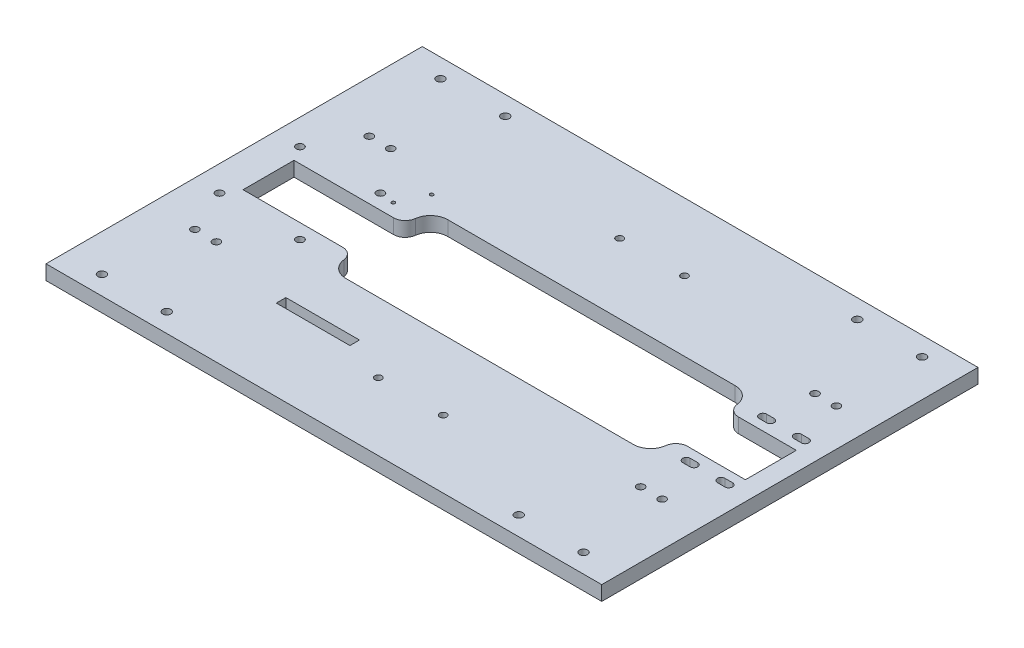
from build123d import *

# Parameters (mm, degrees)
SKETCH1_W           = 480
SKETCH1_H           = 325
BOSS_EXTRUDE1_DEPTH = 12.6
CUT_EXTRUDE1_REACH  = 292.112
SKETCH2_R           = 3
CUT_EXTRUDE2_REACH  = 292.112
FILLET1_R           = 10
CUT_EXTRUDE3_REACH  = 292.112
SKETCH4_R           = 3.3
FILLET2_R           = 10
CUT_EXTRUDE7_REACH  = 292.112
SKETCH7_R           = 2.25
SKETCH8_R           = 3.5
CUT_EXTRUDE8_DEPTH  = 6
CUT_EXTRUDE11_REACH = 292.112
SKETCH12_R          = 1.5
FILLET3_R           = 15
SKETCH14_W          = 63.584161833
SKETCH14_H          = 8.257095536
CUT_EXTRUDE13_DEPTH = 291.112064697
CUT_EXTRUDE14_REACH = 292.112
SKETCH15_R          = 3.25
CUT_EXTRUDE15_REACH = 292.112


with BuildPart() as part:
    # Sketch1 → Boss-Extrude1 (new body)
    with BuildSketch(Plane(origin=(0, 0, 0), x_dir=(1, 0, 0), z_dir=(0, 1, 0))):
        Rectangle(SKETCH1_W, SKETCH1_H)
    extrude(amount=BOSS_EXTRUDE1_DEPTH)

    # Sketch2 → Cut-Extrude1 (cut, up to next)
    with BuildSketch(Plane.XZ, mode=Mode.PRIVATE) as cut_extrude1_sk1:
        with Locations((44.748582867, -104.2)):
            Circle(SKETCH2_R)
    cut_extrude1_tool1 = extrude(cut_extrude1_sk1.sketch, amount=-CUT_EXTRUDE1_REACH, mode=Mode.PRIVATE) & part.part
    # Sketch2 → Cut-Extrude1 (cut, up to next)
    with BuildSketch(Plane.XZ, mode=Mode.PRIVATE) as cut_extrude1_sk2:
        with Locations((-11.251417133, -104.2)):
            Circle(SKETCH2_R)
    cut_extrude1_tool2 = extrude(cut_extrude1_sk2.sketch, amount=-CUT_EXTRUDE1_REACH, mode=Mode.PRIVATE) & part.part
    # Sketch2 → Cut-Extrude1 (cut, up to next)
    with BuildSketch(Plane.XZ, mode=Mode.PRIVATE) as cut_extrude1_sk3:
        with Locations((44.748582867, 104.2)):
            Circle(SKETCH2_R)
    cut_extrude1_tool3 = extrude(cut_extrude1_sk3.sketch, amount=-CUT_EXTRUDE1_REACH, mode=Mode.PRIVATE) & part.part
    # Sketch2 → Cut-Extrude1 (cut, up to next)
    with BuildSketch(Plane.XZ, mode=Mode.PRIVATE) as cut_extrude1_sk4:
        with Locations((-11.251417133, 104.2)):
            Circle(SKETCH2_R)
    cut_extrude1_tool4 = extrude(cut_extrude1_sk4.sketch, amount=-CUT_EXTRUDE1_REACH, mode=Mode.PRIVATE) & part.part
    add(cut_extrude1_tool1.solids().sort_by_distance((44.748583, 0, -104.2))[0], mode=Mode.SUBTRACT)
    add(cut_extrude1_tool2.solids().sort_by_distance((-11.251417, 0, -104.2))[0], mode=Mode.SUBTRACT)
    add(cut_extrude1_tool3.solids().sort_by_distance((44.748583, 0, 104.2))[0], mode=Mode.SUBTRACT)
    add(cut_extrude1_tool4.solids().sort_by_distance((-11.251417, 0, 104.2))[0], mode=Mode.SUBTRACT)

    # Sketch3 → Cut-Extrude2 (cut, up to next)
    with BuildSketch(Plane.XZ, mode=Mode.PRIVATE) as cut_extrude2_sk1:
        Polygon((163.584746975, 44), (-114.288669968, 44), (-114.288669968, 22), (-210.288669968, 22), (-210.288669968, -22), (-114.288669968, -22), (-114.288669968, -44), (163.584746975, -44), (163.584746975, -22), (223.584746975, -22), (223.584746975, 22), (163.584746975, 22), align=None)
    cut_extrude2_tool1 = extrude(cut_extrude2_sk1.sketch, amount=-CUT_EXTRUDE2_REACH, mode=Mode.PRIVATE) & part.part
    add(cut_extrude2_tool1.solids().sort_by_distance((13.675427, 0, 0))[0], mode=Mode.SUBTRACT)

    # Fillet1
    fillet1_edges = [part.edges().sort_by_distance(p)[0] for p in [
        (-114.288669968, 6.3, 22),
        (-114.288669968, 6.3, -22),
    ]]
    fillet(fillet1_edges, radius=FILLET1_R)

    # Sketch4 → Cut-Extrude3 (cut, up to next)
    with BuildSketch(Plane.XZ, mode=Mode.PRIVATE) as cut_extrude3_sk1:
        with Locations((-148.425714853, -34.75)):
            Circle(SKETCH4_R)
    cut_extrude3_tool1 = extrude(cut_extrude3_sk1.sketch, amount=-CUT_EXTRUDE3_REACH, mode=Mode.PRIVATE) & part.part
    # Sketch4 → Cut-Extrude3 (cut, up to next)
    with BuildSketch(Plane.XZ, mode=Mode.PRIVATE) as cut_extrude3_sk2:
        with Locations((-148.425714853, 34.75)):
            Circle(SKETCH4_R)
    cut_extrude3_tool2 = extrude(cut_extrude3_sk2.sketch, amount=-CUT_EXTRUDE3_REACH, mode=Mode.PRIVATE) & part.part
    # Sketch4 → Cut-Extrude3 (cut, up to next)
    with BuildSketch(Plane.XZ, mode=Mode.PRIVATE) as cut_extrude3_sk3:
        with Locations((-217.925714853, 34.75)):
            Circle(SKETCH4_R)
    cut_extrude3_tool3 = extrude(cut_extrude3_sk3.sketch, amount=-CUT_EXTRUDE3_REACH, mode=Mode.PRIVATE) & part.part
    # Sketch4 → Cut-Extrude3 (cut, up to next)
    with BuildSketch(Plane.XZ, mode=Mode.PRIVATE) as cut_extrude3_sk4:
        with Locations((-217.925714853, -34.75)):
            Circle(SKETCH4_R)
    cut_extrude3_tool4 = extrude(cut_extrude3_sk4.sketch, amount=-CUT_EXTRUDE3_REACH, mode=Mode.PRIVATE) & part.part
    add(cut_extrude3_tool1.solids().sort_by_distance((-148.425715, 0, -34.75))[0], mode=Mode.SUBTRACT)
    add(cut_extrude3_tool2.solids().sort_by_distance((-148.425715, 0, 34.75))[0], mode=Mode.SUBTRACT)
    add(cut_extrude3_tool3.solids().sort_by_distance((-217.925715, 0, 34.75))[0], mode=Mode.SUBTRACT)
    add(cut_extrude3_tool4.solids().sort_by_distance((-217.925715, 0, -34.75))[0], mode=Mode.SUBTRACT)

    # Fillet2
    fillet2_edges = [part.edges().sort_by_distance(p)[0] for p in [
        (163.584746975, 6.3, -22),
        (163.584746975, 6.3, 22),
    ]]
    fillet(fillet2_edges, radius=FILLET2_R)

    # Sketch7 → Cut-Extrude7 (cut, up to next)
    with BuildSketch(Plane(origin=(0, 12.6, 0), x_dir=(1, 0, 0), z_dir=(0, 1, 0)), mode=Mode.PRIVATE) as cut_extrude7_sk1:
        with Locations((208, -146.2)):
            Circle(SKETCH7_R)
    cut_extrude7_tool1 = extrude(cut_extrude7_sk1.sketch, amount=-CUT_EXTRUDE7_REACH, mode=Mode.PRIVATE) & part.part
    # Sketch7 → Cut-Extrude7 (cut, up to next)
    with BuildSketch(Plane(origin=(0, 12.6, 0), x_dir=(1, 0, 0), z_dir=(0, 1, 0)), mode=Mode.PRIVATE) as cut_extrude7_sk2:
        with Locations((152, -146.2)):
            Circle(SKETCH7_R)
    cut_extrude7_tool2 = extrude(cut_extrude7_sk2.sketch, amount=-CUT_EXTRUDE7_REACH, mode=Mode.PRIVATE) & part.part
    # Sketch7 → Cut-Extrude7 (cut, up to next)
    with BuildSketch(Plane(origin=(0, 12.6, 0), x_dir=(1, 0, 0), z_dir=(0, 1, 0)), mode=Mode.PRIVATE) as cut_extrude7_sk3:
        with Locations((-152, -146.2)):
            Circle(SKETCH7_R)
    cut_extrude7_tool3 = extrude(cut_extrude7_sk3.sketch, amount=-CUT_EXTRUDE7_REACH, mode=Mode.PRIVATE) & part.part
    # Sketch7 → Cut-Extrude7 (cut, up to next)
    with BuildSketch(Plane(origin=(0, 12.6, 0), x_dir=(1, 0, 0), z_dir=(0, 1, 0)), mode=Mode.PRIVATE) as cut_extrude7_sk4:
        with Locations((-208, -146.2)):
            Circle(SKETCH7_R)
    cut_extrude7_tool4 = extrude(cut_extrude7_sk4.sketch, amount=-CUT_EXTRUDE7_REACH, mode=Mode.PRIVATE) & part.part
    # Sketch7 → Cut-Extrude7 (cut, up to next)
    with BuildSketch(Plane(origin=(0, 12.6, 0), x_dir=(1, 0, 0), z_dir=(0, 1, 0)), mode=Mode.PRIVATE) as cut_extrude7_sk5:
        with Locations((-208, 146.2)):
            Circle(SKETCH7_R)
    cut_extrude7_tool5 = extrude(cut_extrude7_sk5.sketch, amount=-CUT_EXTRUDE7_REACH, mode=Mode.PRIVATE) & part.part
    # Sketch7 → Cut-Extrude7 (cut, up to next)
    with BuildSketch(Plane(origin=(0, 12.6, 0), x_dir=(1, 0, 0), z_dir=(0, 1, 0)), mode=Mode.PRIVATE) as cut_extrude7_sk6:
        with Locations((-152, 146.2)):
            Circle(SKETCH7_R)
    cut_extrude7_tool6 = extrude(cut_extrude7_sk6.sketch, amount=-CUT_EXTRUDE7_REACH, mode=Mode.PRIVATE) & part.part
    # Sketch7 → Cut-Extrude7 (cut, up to next)
    with BuildSketch(Plane(origin=(0, 12.6, 0), x_dir=(1, 0, 0), z_dir=(0, 1, 0)), mode=Mode.PRIVATE) as cut_extrude7_sk7:
        with Locations((208, 146.2)):
            Circle(SKETCH7_R)
    cut_extrude7_tool7 = extrude(cut_extrude7_sk7.sketch, amount=-CUT_EXTRUDE7_REACH, mode=Mode.PRIVATE) & part.part
    # Sketch7 → Cut-Extrude7 (cut, up to next)
    with BuildSketch(Plane(origin=(0, 12.6, 0), x_dir=(1, 0, 0), z_dir=(0, 1, 0)), mode=Mode.PRIVATE) as cut_extrude7_sk8:
        with Locations((152, 146.2)):
            Circle(SKETCH7_R)
    cut_extrude7_tool8 = extrude(cut_extrude7_sk8.sketch, amount=-CUT_EXTRUDE7_REACH, mode=Mode.PRIVATE) & part.part
    add(cut_extrude7_tool1.solids().sort_by_distance((208, 12.6, 146.2))[0], mode=Mode.SUBTRACT)
    add(cut_extrude7_tool2.solids().sort_by_distance((152, 12.6, 146.2))[0], mode=Mode.SUBTRACT)
    add(cut_extrude7_tool3.solids().sort_by_distance((-152, 12.6, 146.2))[0], mode=Mode.SUBTRACT)
    add(cut_extrude7_tool4.solids().sort_by_distance((-208, 12.6, 146.2))[0], mode=Mode.SUBTRACT)
    add(cut_extrude7_tool5.solids().sort_by_distance((-208, 12.6, -146.2))[0], mode=Mode.SUBTRACT)
    add(cut_extrude7_tool6.solids().sort_by_distance((-152, 12.6, -146.2))[0], mode=Mode.SUBTRACT)
    add(cut_extrude7_tool7.solids().sort_by_distance((208, 12.6, -146.2))[0], mode=Mode.SUBTRACT)
    add(cut_extrude7_tool8.solids().sort_by_distance((152, 12.6, -146.2))[0], mode=Mode.SUBTRACT)

    # Sketch8 → Cut-Extrude8 (cut)
    with BuildSketch(Plane(origin=(0, 12.6, 0), x_dir=(1, 0, 0), z_dir=(0, 1, 0))):
        with Locations((208, 146.2)):
            Circle(SKETCH8_R)
        with Locations((152, 146.2)):
            Circle(SKETCH8_R)
        with Locations((-152, 146.2)):
            Circle(SKETCH8_R)
        with Locations((-208, 146.2)):
            Circle(SKETCH8_R)
        with Locations((208, -146.2)):
            Circle(SKETCH8_R)
        with Locations((152, -146.2)):
            Circle(SKETCH8_R)
        with Locations((-208, -146.2)):
            Circle(SKETCH8_R)
        with Locations((-152, -146.2)):
            Circle(SKETCH8_R)
    extrude(amount=-CUT_EXTRUDE8_DEPTH, mode=Mode.SUBTRACT)

    # Sketch12 → Cut-Extrude11 (cut, up to next)
    with BuildSketch(Plane.XZ, mode=Mode.PRIVATE) as cut_extrude11_sk1:
        with Locations((-135.814791711, -33.263055365)):
            Circle(SKETCH12_R)
    cut_extrude11_tool1 = extrude(cut_extrude11_sk1.sketch, amount=-CUT_EXTRUDE11_REACH, mode=Mode.PRIVATE) & part.part
    # Sketch12 → Cut-Extrude11 (cut, up to next)
    with BuildSketch(Plane.XZ, mode=Mode.PRIVATE) as cut_extrude11_sk2:
        with Locations((-125.214791711, -55.863055365)):
            Circle(SKETCH12_R)
    cut_extrude11_tool2 = extrude(cut_extrude11_sk2.sketch, amount=-CUT_EXTRUDE11_REACH, mode=Mode.PRIVATE) & part.part
    add(cut_extrude11_tool1.solids().sort_by_distance((-135.814792, 0, -33.263055))[0], mode=Mode.SUBTRACT)
    add(cut_extrude11_tool2.solids().sort_by_distance((-125.214792, 0, -55.863055))[0], mode=Mode.SUBTRACT)

    # Fillet3
    fillet3_edges = [part.edges().sort_by_distance(p)[0] for p in [
        (163.584746975, 6.3, 44),
        (163.584746975, 6.3, -44),
        (-114.288669968, 6.3, 44),
        (-114.288669968, 6.3, -44),
    ]]
    fillet(fillet3_edges, radius=FILLET3_R)

    # Sketch14 → Cut-Extrude13 (cut, through all)
    with BuildSketch(Plane(origin=(0, 12.6, 0), x_dir=(1, 0, 0), z_dir=(0, 1, 0))):
        with Locations((-79.365102285, -88.291865052)):
            Rectangle(SKETCH14_W, SKETCH14_H)
    extrude(amount=-CUT_EXTRUDE13_DEPTH, mode=Mode.SUBTRACT)

    # Sketch15 → Cut-Extrude14 (cut, up to next)
    with BuildSketch(Plane(origin=(0, 12.6, 0), x_dir=(1, 0, 0), z_dir=(0, 1, 0)), mode=Mode.PRIVATE) as cut_extrude14_sk1:
        with Locations((-201.37519906, -72.5)):
            Circle(SKETCH15_R)
    cut_extrude14_tool1 = extrude(cut_extrude14_sk1.sketch, amount=-CUT_EXTRUDE14_REACH, mode=Mode.PRIVATE) & part.part
    # Sketch15 → Cut-Extrude14 (cut, up to next)
    with BuildSketch(Plane(origin=(0, 12.6, 0), x_dir=(1, 0, 0), z_dir=(0, 1, 0)), mode=Mode.PRIVATE) as cut_extrude14_sk2:
        with Locations((-182.864719491, -72.5)):
            Circle(SKETCH15_R)
    cut_extrude14_tool2 = extrude(cut_extrude14_sk2.sketch, amount=-CUT_EXTRUDE14_REACH, mode=Mode.PRIVATE) & part.part
    # Sketch15 → Cut-Extrude14 (cut, up to next)
    with BuildSketch(Plane(origin=(0, 12.6, 0), x_dir=(1, 0, 0), z_dir=(0, 1, 0)), mode=Mode.PRIVATE) as cut_extrude14_sk3:
        with Locations((-195.791828434, 72.5)):
            Circle(SKETCH15_R)
    cut_extrude14_tool3 = extrude(cut_extrude14_sk3.sketch, amount=-CUT_EXTRUDE14_REACH, mode=Mode.PRIVATE) & part.part
    # Sketch15 → Cut-Extrude14 (cut, up to next)
    with BuildSketch(Plane(origin=(0, 12.6, 0), x_dir=(1, 0, 0), z_dir=(0, 1, 0)), mode=Mode.PRIVATE) as cut_extrude14_sk4:
        with Locations((-177.281348865, 72.5)):
            Circle(SKETCH15_R)
    cut_extrude14_tool4 = extrude(cut_extrude14_sk4.sketch, amount=-CUT_EXTRUDE14_REACH, mode=Mode.PRIVATE) & part.part
    # Sketch15 → Cut-Extrude14 (cut, up to next)
    with BuildSketch(Plane(origin=(0, 12.6, 0), x_dir=(1, 0, 0), z_dir=(0, 1, 0)), mode=Mode.PRIVATE) as cut_extrude14_sk5:
        with Locations((189.208171566, 72.5)):
            Circle(SKETCH15_R)
    cut_extrude14_tool5 = extrude(cut_extrude14_sk5.sketch, amount=-CUT_EXTRUDE14_REACH, mode=Mode.PRIVATE) & part.part
    # Sketch15 → Cut-Extrude14 (cut, up to next)
    with BuildSketch(Plane(origin=(0, 12.6, 0), x_dir=(1, 0, 0), z_dir=(0, 1, 0)), mode=Mode.PRIVATE) as cut_extrude14_sk6:
        with Locations((207.718651135, 72.5)):
            Circle(SKETCH15_R)
    cut_extrude14_tool6 = extrude(cut_extrude14_sk6.sketch, amount=-CUT_EXTRUDE14_REACH, mode=Mode.PRIVATE) & part.part
    # Sketch15 → Cut-Extrude14 (cut, up to next)
    with BuildSketch(Plane(origin=(0, 12.6, 0), x_dir=(1, 0, 0), z_dir=(0, 1, 0)), mode=Mode.PRIVATE) as cut_extrude14_sk7:
        with Locations((183.62480094, -72.5)):
            Circle(SKETCH15_R)
    cut_extrude14_tool7 = extrude(cut_extrude14_sk7.sketch, amount=-CUT_EXTRUDE14_REACH, mode=Mode.PRIVATE) & part.part
    # Sketch15 → Cut-Extrude14 (cut, up to next)
    with BuildSketch(Plane(origin=(0, 12.6, 0), x_dir=(1, 0, 0), z_dir=(0, 1, 0)), mode=Mode.PRIVATE) as cut_extrude14_sk8:
        with Locations((202.135280509, -72.5)):
            Circle(SKETCH15_R)
    cut_extrude14_tool8 = extrude(cut_extrude14_sk8.sketch, amount=-CUT_EXTRUDE14_REACH, mode=Mode.PRIVATE) & part.part
    add(cut_extrude14_tool1.solids().sort_by_distance((-201.375199, 12.6, 72.5))[0], mode=Mode.SUBTRACT)
    add(cut_extrude14_tool2.solids().sort_by_distance((-182.864719, 12.6, 72.5))[0], mode=Mode.SUBTRACT)
    add(cut_extrude14_tool3.solids().sort_by_distance((-195.791828, 12.6, -72.5))[0], mode=Mode.SUBTRACT)
    add(cut_extrude14_tool4.solids().sort_by_distance((-177.281349, 12.6, -72.5))[0], mode=Mode.SUBTRACT)
    add(cut_extrude14_tool5.solids().sort_by_distance((189.208172, 12.6, -72.5))[0], mode=Mode.SUBTRACT)
    add(cut_extrude14_tool6.solids().sort_by_distance((207.718651, 12.6, -72.5))[0], mode=Mode.SUBTRACT)
    add(cut_extrude14_tool7.solids().sort_by_distance((183.624801, 12.6, 72.5))[0], mode=Mode.SUBTRACT)
    add(cut_extrude14_tool8.solids().sort_by_distance((202.135281, 12.6, 72.5))[0], mode=Mode.SUBTRACT)

    # Sketch16 → Cut-Extrude15 (cut, up to next)
    with BuildSketch(Plane(origin=(0, 12.6, 0), x_dir=(1, 0, 0), z_dir=(0, 1, 0)), mode=Mode.PRIVATE) as cut_extrude15_sk1:
        with BuildLine():
            Line((183.672880587, -36.25), (190.172880587, -36.25))
            ThreePointArc((190.172880587, -36.25), (193.422880587, -33), (190.172880587, -29.75))
            Line((190.172880587, -29.75), (183.672880587, -29.75))
            ThreePointArc((183.672880587, -29.75), (180.422880587, -33), (183.672880587, -36.25))
        make_face()
    cut_extrude15_tool1 = extrude(cut_extrude15_sk1.sketch, amount=-CUT_EXTRUDE15_REACH, mode=Mode.PRIVATE) & part.part
    # Sketch16 → Cut-Extrude15 (cut, up to next)
    with BuildSketch(Plane(origin=(0, 12.6, 0), x_dir=(1, 0, 0), z_dir=(0, 1, 0)), mode=Mode.PRIVATE) as cut_extrude15_sk2:
        with BuildLine():
            Line((213.672880587, -36.25), (220.172880587, -36.25))
            ThreePointArc((220.172880587, -36.25), (223.422880587, -33), (220.172880587, -29.75))
            Line((220.172880587, -29.75), (213.672880587, -29.75))
            ThreePointArc((213.672880587, -29.75), (210.422880587, -33), (213.672880587, -36.25))
        make_face()
    cut_extrude15_tool2 = extrude(cut_extrude15_sk2.sketch, amount=-CUT_EXTRUDE15_REACH, mode=Mode.PRIVATE) & part.part
    # Sketch16 → Cut-Extrude15 (cut, up to next)
    with BuildSketch(Plane(origin=(0, 12.6, 0), x_dir=(1, 0, 0), z_dir=(0, 1, 0)), mode=Mode.PRIVATE) as cut_extrude15_sk3:
        with BuildLine():
            Line((183.672880587, 29.75), (190.172880587, 29.75))
            ThreePointArc((190.172880587, 29.75), (193.422880587, 33), (190.172880587, 36.25))
            Line((190.172880587, 36.25), (183.672880587, 36.25))
            ThreePointArc((183.672880587, 36.25), (180.422880587, 33), (183.672880587, 29.75))
        make_face()
    cut_extrude15_tool3 = extrude(cut_extrude15_sk3.sketch, amount=-CUT_EXTRUDE15_REACH, mode=Mode.PRIVATE) & part.part
    # Sketch16 → Cut-Extrude15 (cut, up to next)
    with BuildSketch(Plane(origin=(0, 12.6, 0), x_dir=(1, 0, 0), z_dir=(0, 1, 0)), mode=Mode.PRIVATE) as cut_extrude15_sk4:
        with BuildLine():
            Line((213.672880587, 29.75), (220.172880587, 29.75))
            ThreePointArc((220.172880587, 29.75), (223.422880587, 33), (220.172880587, 36.25))
            Line((220.172880587, 36.25), (213.672880587, 36.25))
            ThreePointArc((213.672880587, 36.25), (210.422880587, 33), (213.672880587, 29.75))
        make_face()
    cut_extrude15_tool4 = extrude(cut_extrude15_sk4.sketch, amount=-CUT_EXTRUDE15_REACH, mode=Mode.PRIVATE) & part.part
    add(cut_extrude15_tool1.solids().sort_by_distance((186.922881, 12.6, 33))[0], mode=Mode.SUBTRACT)
    add(cut_extrude15_tool2.solids().sort_by_distance((216.922881, 12.6, 33))[0], mode=Mode.SUBTRACT)
    add(cut_extrude15_tool3.solids().sort_by_distance((186.922881, 12.6, -33))[0], mode=Mode.SUBTRACT)
    add(cut_extrude15_tool4.solids().sort_by_distance((216.922881, 12.6, -33))[0], mode=Mode.SUBTRACT)


solid = part.part
